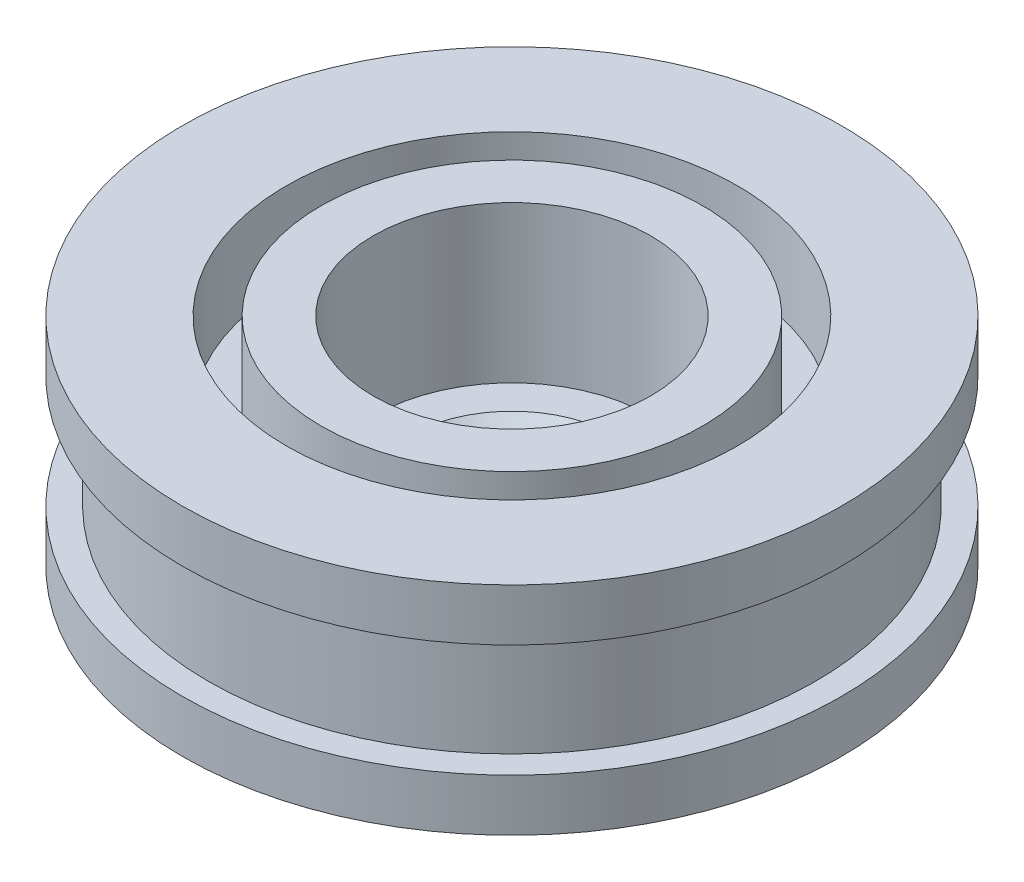
from build123d import *

# Parameters (mm, degrees)
F_8_0MM_DOWEL_HOLE2_D = 8
SKETCH8_R             = 8
CUT_EXTRUDE1_DEPTH    = 9
CHAMFER1_SIZE         = 2
SKETCH9_R             = 13
SKETCH9_R_2           = 11
CUT_EXTRUDE2_DEPTH    = 5


with BuildPart() as part:
    # Sketch1 → Revolve1 (revolve)
    with BuildSketch(Plane.XY):
        Polygon((0, 0), (19, 0), (19, 3), (17.5, 3), (17.5, 9.5), (19, 9.5), (19, 12.5), (0, 12.5), align=None)
    revolve(axis=Axis((0, 12.5, 0), (0, -1, 0)))

    # Ø8.0mm Dowel Hole2 (through all)
    with Locations(Plane(origin=(0, 12.5, 0), x_dir=(1, 0, 0), z_dir=(0, 1, 0))):
        with Locations((0, 0)):
            Hole(F_8_0MM_DOWEL_HOLE2_D / 2)

    # Sketch8 → Cut-Extrude1 (cut)
    with BuildSketch(Plane(origin=(0, 12.5, 0), x_dir=(1, 0, 0), z_dir=(0, 1, 0))):
        Circle(SKETCH8_R)
    extrude(amount=-CUT_EXTRUDE1_DEPTH, mode=Mode.SUBTRACT)

    # Chamfer1
    chamfer1_edges = [part.edges().sort_by_distance(p)[0] for p in [
        (4, 3.5, 0),
    ]]
    chamfer(chamfer1_edges, length=CHAMFER1_SIZE)

    # Sketch9 → Cut-Extrude2 (cut)
    with BuildSketch(Plane(origin=(0, 12.5, 0), x_dir=(1, 0, 0), z_dir=(0, 1, 0))):
        Circle(SKETCH9_R)
        Circle(SKETCH9_R_2, mode=Mode.SUBTRACT)
    extrude(amount=-CUT_EXTRUDE2_DEPTH, mode=Mode.SUBTRACT)


solid = part.part
